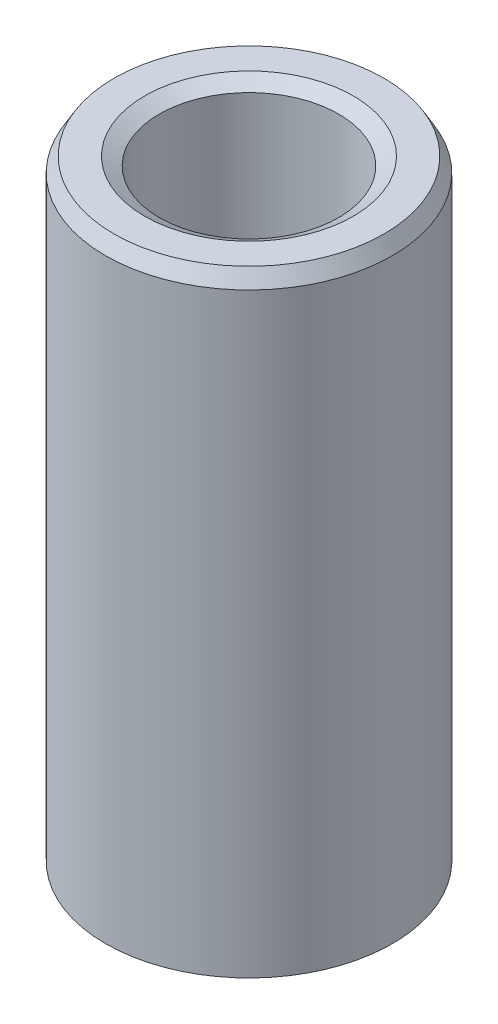
from build123d import *
from OCP.BRepFilletAPI import BRepFilletAPI_MakeChamfer

# Parameters (mm, degrees)
SKETCH1_R           = 7.5
BOSS_EXTRUDE1_DEPTH = 32.3666149
SKETCH2_R           = 4.691832039
CUT_EXTRUDE1_DEPTH  = 35.060207869
CHAMFER1_SIZE       = 0.763945282
CHAMFER1_SIZE2      = 0.441064014


with BuildPart() as part:
    # Sketch1 → Boss-Extrude1 (new body)
    with BuildSketch(Plane(origin=(0, 0, 0), x_dir=(1, 0, 0), z_dir=(0, 1, 0))):
        Circle(SKETCH1_R)
    extrude(amount=BOSS_EXTRUDE1_DEPTH)

    # Sketch2 → Cut-Extrude1 (cut, through all)
    with BuildSketch(Plane(origin=(0, 0, 0), x_dir=(1, 0, 0), z_dir=(0, 1, 0))):
        Circle(SKETCH2_R)
    extrude(amount=CUT_EXTRUDE1_DEPTH, mode=Mode.SUBTRACT)

    # Chamfer1: one chamfer whose edges measure the first distance from different faces: ONE call of the kernel's chamfer builder (chamfer() names one face for all edges)
    chamfer1_edges_1 = [part.edges().sort_by_distance(p)[0] for p in [
        (-4.691832039, 32.3666149, 0),
    ]]
    chamfer1_side_1 = [part.faces().sort_by_distance(p)[0] for p in [
        (-7.287867966, 32.3666149, 0),
    ]]
    chamfer1_edges_2 = [part.edges().sort_by_distance(p)[0] for p in [
        (-4.691832039, 0, 0),
    ]]
    chamfer1_side_2 = [part.faces().sort_by_distance(p)[0] for p in [
        (-4.691832039, 16.18330745, 0),
    ]]
    chamfer1_edges_3 = [part.edges().sort_by_distance(p)[0] for p in [
        (-7.5, 0, 0),
    ]]
    chamfer1_side_3 = [part.faces().sort_by_distance(p)[0] for p in [
        (-7.287867966, 0, 0),
    ]]
    chamfer1_edges_4 = [part.edges().sort_by_distance(p)[0] for p in [
        (-7.5, 32.3666149, 0),
    ]]
    chamfer1_side_4 = [part.faces().sort_by_distance(p)[0] for p in [
        (-7.5, 16.18330745, 0),
    ]]
    chamfer1 = BRepFilletAPI_MakeChamfer(part.part.solid().wrapped)
    for e in chamfer1_edges_1:
        chamfer1.Add(CHAMFER1_SIZE, CHAMFER1_SIZE2, e.wrapped, chamfer1_side_1[0].wrapped)  # the first distance lies on this face
    for e in chamfer1_edges_2:
        chamfer1.Add(CHAMFER1_SIZE, CHAMFER1_SIZE2, e.wrapped, chamfer1_side_2[0].wrapped)  # the first distance lies on this face
    for e in chamfer1_edges_3:
        chamfer1.Add(CHAMFER1_SIZE, CHAMFER1_SIZE2, e.wrapped, chamfer1_side_3[0].wrapped)  # the first distance lies on this face
    for e in chamfer1_edges_4:
        chamfer1.Add(CHAMFER1_SIZE, CHAMFER1_SIZE2, e.wrapped, chamfer1_side_4[0].wrapped)  # the first distance lies on this face
    add(Compound.cast(chamfer1.Shape()), mode=Mode.REPLACE)


solid = part.part
